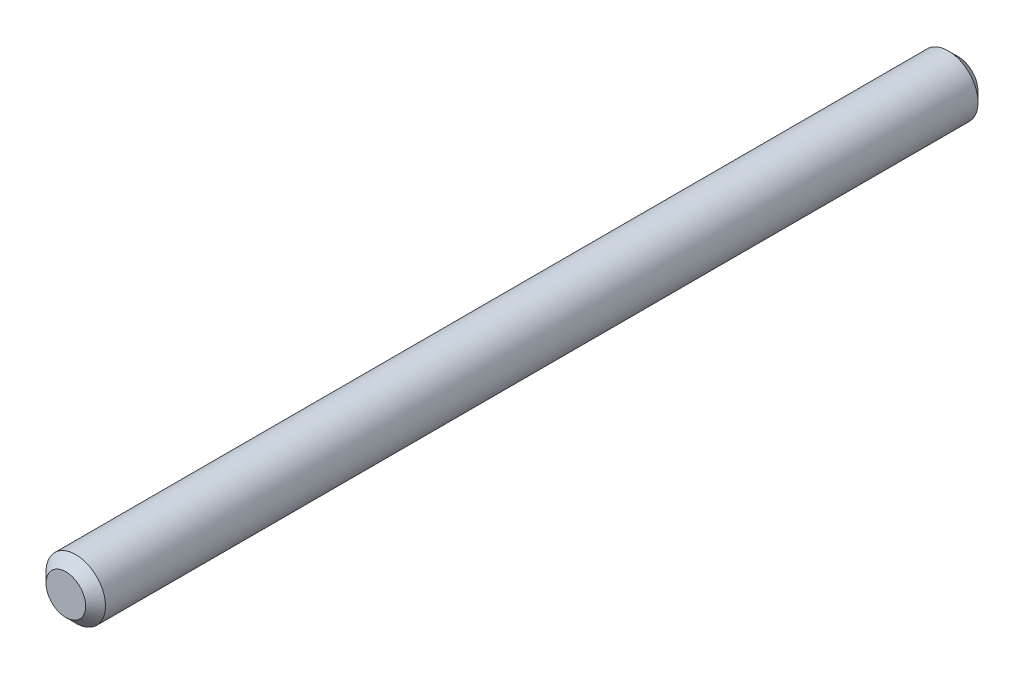
from build123d import *

# Parameters (mm, degrees)
SKETCH_1_R      = 1.5
EXTRUDE_1_DEPTH = 45
CHAMFER_1_SIZE  = 0.5


with BuildPart() as part:
    # 草图1 → 凸台-拉伸1 (new body)
    with BuildSketch(Plane.XY):
        Circle(SKETCH_1_R)
    extrude(amount=EXTRUDE_1_DEPTH)

    # 倒角1
    chamfer_1_edges = [part.edges().sort_by_distance(p)[0] for p in [
        (-1.5, 0, 0),
        (-1.5, 0, 45),
    ]]
    chamfer(chamfer_1_edges, length=CHAMFER_1_SIZE)


solid = part.part
